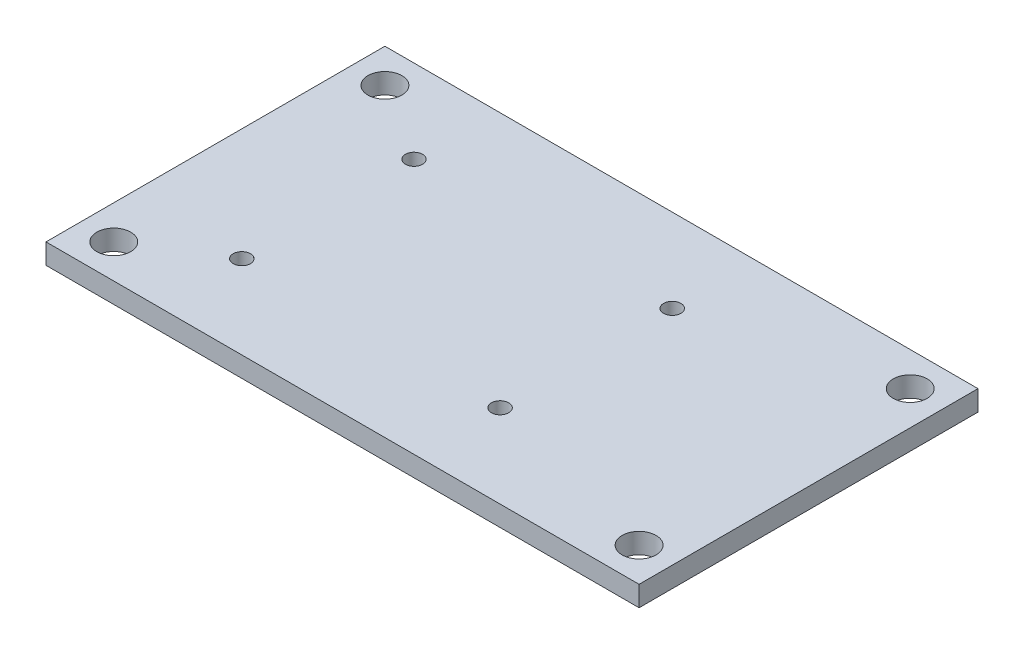
from build123d import *

# Parameters (mm, degrees)
SKETCH1_W           = 175
SKETCH1_H           = 100
SKETCH1_R           = 3.175
BOSS_EXTRUDE1_DEPTH = 6
SKETCH2_R           = 5
SKETCH2_R_2         = 2.555
CUT_EXTRUDE1_DEPTH  = 101.956673875


with BuildPart() as part:
    # Sketch1 → Boss-Extrude1 (new body)
    with BuildSketch(Plane(origin=(0, 0, 0), x_dir=(1, 0, 0), z_dir=(0, 1, 0))):
        Rectangle(SKETCH1_W, SKETCH1_H)
        with Locations((-77.5, -40)):
            Circle(SKETCH1_R, mode=Mode.SUBTRACT)
        with Locations((-77.5, 40)):
            Circle(SKETCH1_R, mode=Mode.SUBTRACT)
        with Locations((77.5, 40)):
            Circle(SKETCH1_R, mode=Mode.SUBTRACT)
        with Locations((77.5, -40)):
            Circle(SKETCH1_R, mode=Mode.SUBTRACT)
    extrude(amount=BOSS_EXTRUDE1_DEPTH)

    # Sketch2 → Cut-Extrude1 (cut, through all)
    with BuildSketch(Plane(origin=(0, 6, 0), x_dir=(1, 0, 0), z_dir=(0, 1, 0))):
        with Locations((-77.5, 40)):
            Circle(SKETCH2_R)
        with Locations((-77.5, -40)):
            Circle(SKETCH2_R)
        with Locations((77.5, -40)):
            Circle(SKETCH2_R)
        with Locations((77.5, 40)):
            Circle(SKETCH2_R)
        with Locations((21.88, -25.4)):
            Circle(SKETCH2_R_2)
        with Locations((-54.32, -25.4)):
            Circle(SKETCH2_R_2)
        with Locations((21.88, 25.4)):
            Circle(SKETCH2_R_2)
        with Locations((-54.32, 25.4)):
            Circle(SKETCH2_R_2)
    extrude(amount=-CUT_EXTRUDE1_DEPTH, mode=Mode.SUBTRACT)


solid = part.part
